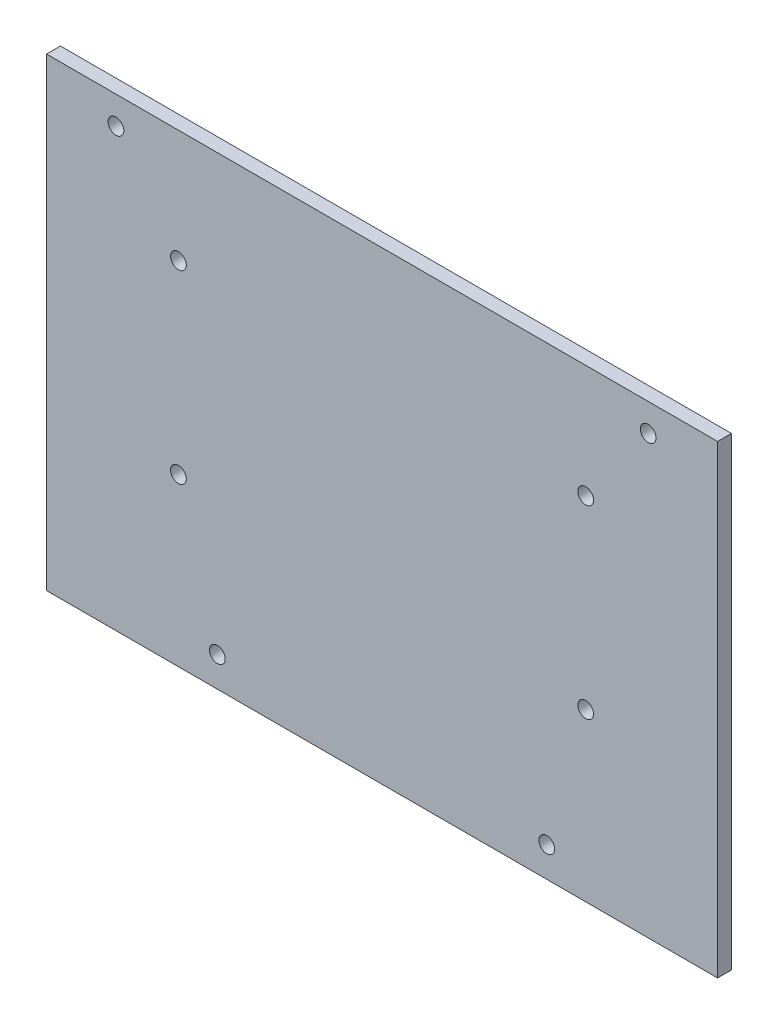
from build123d import *

# Parameters (mm, degrees)
SKETCH1_W             = 145
SKETCH1_H             = 100.4
BOSS_EXTRUDE1_DEPTH   = 3
SKETCH3_R             = 1.7
DEPENDENT_HOLES_DEPTH = 10


with BuildPart() as part:
    # Sketch1 → Boss-Extrude1 (new body)
    with BuildSketch(Plane.XY):
        with Locations((0, 50.2)):
            Rectangle(SKETCH1_W, SKETCH1_H)
    extrude(amount=BOSS_EXTRUDE1_DEPTH)

    # Sketch3 → dependent_holes (cut)
    with BuildSketch(Plane.XY.offset(3)):
        with Locations((-57.5, 94.4)):
            Circle(SKETCH3_R)
        with Locations((57.5, 94.4)):
            Circle(SKETCH3_R)
        with Locations((-44, 75.982855114)):
            Circle(SKETCH3_R)
        with Locations((-44, 35.982855114)):
            Circle(SKETCH3_R)
        with Locations((44, 35.982855114)):
            Circle(SKETCH3_R)
        with Locations((44, 75.982855114)):
            Circle(SKETCH3_R)
        with Locations((-35.5875, 6.5)):
            Circle(SKETCH3_R)
        with Locations((35.5875, 6.5)):
            Circle(SKETCH3_R)
    extrude(amount=-DEPENDENT_HOLES_DEPTH, mode=Mode.SUBTRACT)


solid = part.part
